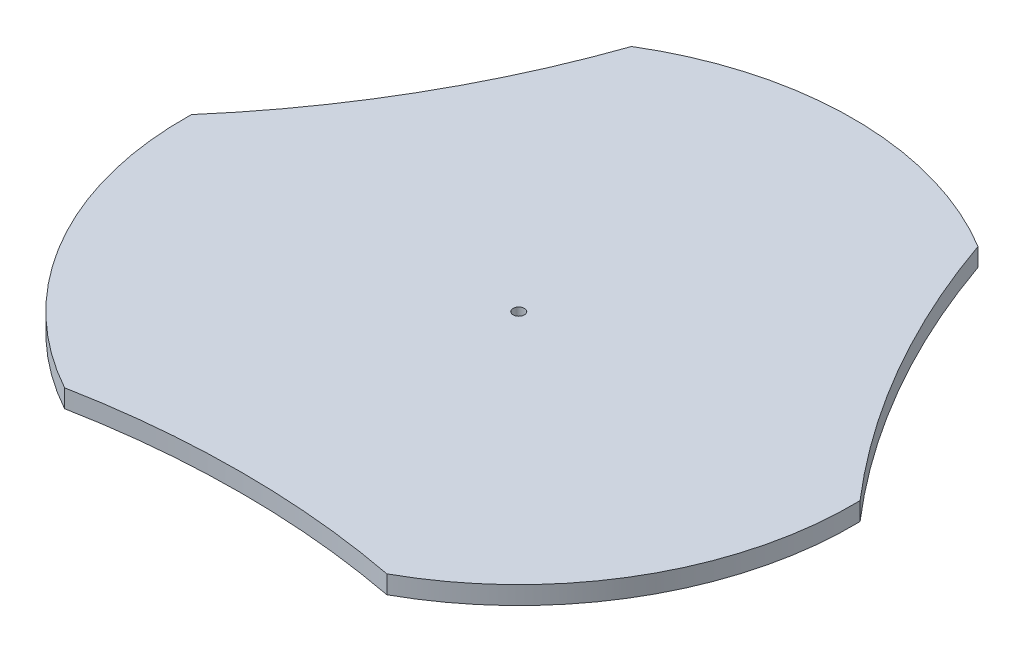
from build123d import *

# Parameters (mm, degrees)
SKETCH1_R           = 37
BOSS_EXTRUDE1_DEPTH = 1.6
SKETCH5_R           = 75.500139874
CUT_EXTRUDE2_DEPTH  = 53.350358165
SKETCH7_R           = 0.5
CUT_EXTRUDE3_DEPTH  = 53.350358165
SKETCH3_R           = 1.75
CUT_EXTRUDE4_DEPTH  = 53.350358165
SKETCH8_R           = 1.65
CUT_EXTRUDE5_DEPTH  = 53.350358165
CIRPATTERN2_COUNT   = 3
SKETCH10_OUTSIDE_W  = 94.454
SKETCH10_OUTSIDE_H  = 86.922
SKETCH10_OUTSIDE_R  = 29.5
CUT_EXTRUDE7_DEPTH  = 10


with BuildPart() as part:
    # Sketch1 → Boss-Extrude1 (new body)
    with BuildSketch(Plane(origin=(0, 0, 0), x_dir=(1, 0, 0), z_dir=(0, 1, 0))):
        Circle(SKETCH1_R)
    extrude(amount=BOSS_EXTRUDE1_DEPTH)

    # Sketch5 → Cut-Extrude2 (cut, through all)
    with BuildSketch(Plane(origin=(0, 1.6, 0), x_dir=(1, 0, 0), z_dir=(0, 1, 0))):
        with Locations((86.602540378, 50)):
            Circle(SKETCH5_R)
    cut_extrude2 = extrude(amount=-CUT_EXTRUDE2_DEPTH, mode=Mode.SUBTRACT)

    # Sketch7 → Cut-Extrude3 (cut, through all)
    with BuildSketch(Plane(origin=(0, 1.6, 0), x_dir=(1, 0, 0), z_dir=(0, 1, 0))):
        Circle(SKETCH7_R)
    extrude(amount=-CUT_EXTRUDE3_DEPTH, mode=Mode.SUBTRACT)

    # Sketch3 → Cut-Extrude4 (cut, through all)
    with BuildSketch(Plane(origin=(0, 1.6, 0), x_dir=(1, 0, 0), z_dir=(0, 1, 0))):
        with Locations((2.788983768, 31.878230339)):
            Circle(SKETCH3_R)
        with Locations((26.212865417, -18.354445963)):
            Circle(SKETCH3_R)
        with Locations((-29.001849185, -13.523784376)):
            Circle(SKETCH3_R)
    extrude(amount=-CUT_EXTRUDE4_DEPTH, mode=Mode.SUBTRACT)

    # Sketch8 → Cut-Extrude5 (cut, through all)
    with BuildSketch(Plane(origin=(0, 1.6, 0), x_dir=(1, 0, 0), z_dir=(0, 1, 0))):
        with Locations((-5.904038041, 33.483463602)):
            Circle(SKETCH8_R)
    cut_extrude5 = extrude(amount=-CUT_EXTRUDE5_DEPTH, mode=Mode.SUBTRACT)

    # CirPattern2: Cut-Extrude2, Cut-Extrude5 ×3 about axis
    cirpattern2_axis = Axis((0, 1.6, 0), (0, -1, 0))
    add([cut_extrude2.rotate(cirpattern2_axis, i * 360 / CIRPATTERN2_COUNT) for i in range(1, CIRPATTERN2_COUNT)], mode=Mode.SUBTRACT)
    add([cut_extrude5.rotate(cirpattern2_axis, i * 360 / CIRPATTERN2_COUNT) for i in range(1, CIRPATTERN2_COUNT)], mode=Mode.SUBTRACT)

    # Sketch10 outside → Cut-Extrude7 (cut)
    with BuildSketch(Plane(origin=(0, 1.6, 0), x_dir=(1, 0, 0), z_dir=(0, 1, 0))):
        with Locations((0, 4.328)):
            Rectangle(SKETCH10_OUTSIDE_W, SKETCH10_OUTSIDE_H)
        Circle(SKETCH10_OUTSIDE_R, mode=Mode.SUBTRACT)
    extrude(amount=-CUT_EXTRUDE7_DEPTH, mode=Mode.SUBTRACT)


solid = part.part
